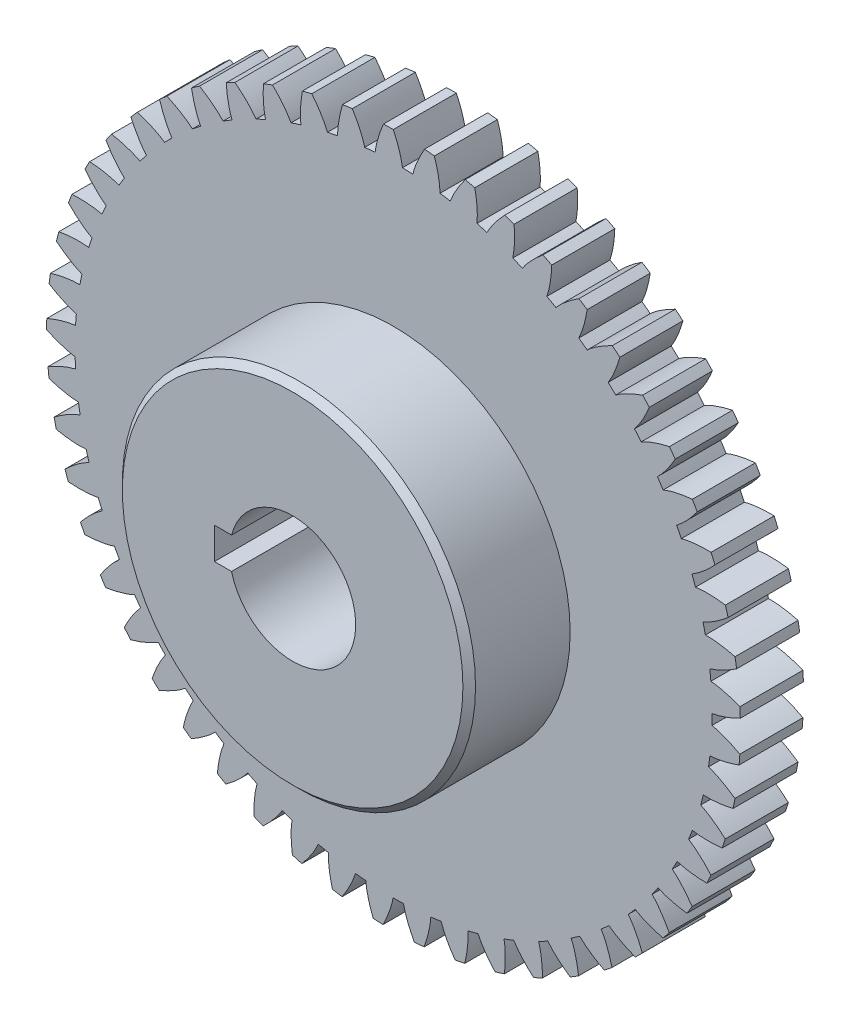
from build123d import *

# Parameters (mm, degrees)
SKETCH_1_R               = 25.25
EXTRUDE_1_DEPTH          = 5
EXTRUDE_2_DEPTH          = 5
PATTERN_CIRCULAR_1_COUNT = 53
SKETCH_3_R               = 14
EXTRUDE_3_DEPTH          = 8
CHAMFER_1_SIZE           = 0.5
CUT_EXTRUDE_1_DEPTH      = 42.006089163


with BuildPart() as part:
    # 草图1 → 凸台-拉伸1 (new body)
    with BuildSketch(Plane.XY):
        Circle(SKETCH_1_R)
    extrude(amount=EXTRUDE_1_DEPTH)

    # 草图2 → 凸台-拉伸2 (add)
    with BuildSketch(Plane.XY):
        with BuildLine():
            ThreePointArc((27.452630056, 1.613413465), (27.472724589, 1.224501392), (27.487309814, 0.835343761))
            add(Edge.make_bspline(
                [(27.487309814, 0.835343761), (27.207352322, 0.69369382), (26.782266996, 0.499377944), (26.203100913, 0.284395373), (25.632137008, 0.108475957), (25.195839623, 0.017497177), (24.901854451, 0)],
                knots=[0, 0, 0, 0, 0.344415994, 0.512486315, 0.677794751, 1, 1, 1, 1], degree=3))
            ThreePointArc((24.901854451, 0), (24.877155967, 1.108812925), (24.803109508, 2.215426335))
            add(Edge.make_bspline(
                [(27.452630056, 1.613413465), (27.161180624, 1.729594924), (26.720493348, 1.88532199), (26.124497662, 2.047925802), (25.540146935, 2.172351076), (25.09748558, 2.22415332), (24.803109508, 2.215426335)],
                knots=[0, 0, 0, 0, 0.344415994, 0.512486315, 0.677794751, 1, 1, 1, 1], degree=3))
        make_face()
    extrude_2 = extrude(amount=EXTRUDE_2_DEPTH)

    # 阵列(圆周)1: 凸台-拉伸2 ×53 about axis
    pattern_circular_1_axis = Axis((0, 0, 5), (0, 0, -1))
    for i in range(1, PATTERN_CIRCULAR_1_COUNT):
        add(extrude_2.rotate(pattern_circular_1_axis, i * 360 / PATTERN_CIRCULAR_1_COUNT))

    # 草图3 → 凸台-拉伸3 (add)
    with BuildSketch(Plane.XY.offset(5)):
        Circle(SKETCH_3_R)
    extrude(amount=EXTRUDE_3_DEPTH)

    # 倒角1
    chamfer_1_edges = [part.edges().sort_by_distance(p)[0] for p in [
        (-14, 0, 13),
    ]]
    chamfer(chamfer_1_edges, length=CHAMFER_1_SIZE)

    # 草图4 → 切除-拉伸1 (cut, through all)
    with BuildSketch(Plane.XY.offset(13)):
        with BuildLine():
            Line((-4.841229183, 1.25), (-6.2, 1.25))
            Line((-6.2, 1.25), (-6.2, -1.25))
            Line((-6.2, -1.25), (-4.841229183, -1.25))
            ThreePointArc((-4.841229183, -1.25), (5, 0), (-4.841229183, 1.25))
        make_face()
    extrude(amount=-CUT_EXTRUDE_1_DEPTH, mode=Mode.SUBTRACT)


solid = part.part
